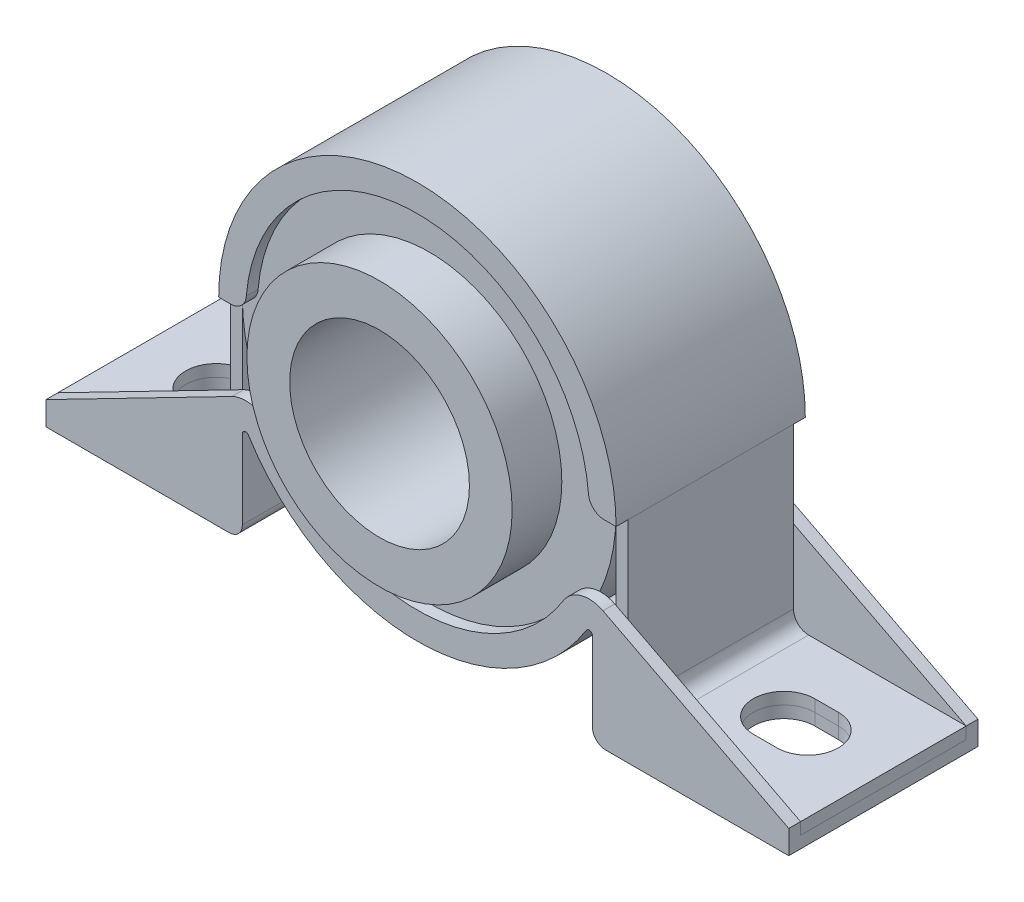
from build123d import *

# Parameters (mm, degrees)
EXTRUDE_THIN2_DEPTH  = 15.875
EXTRUDE1_DEPTH       = 1.984375
EXTRUDE_THIN3_START  = -13.890625
EXTRUDE_THIN3_DEPTH  = 27.78125
EXTRUDE2_DEPTH       = 1.984375
EXTRUDE3_START       = -13.890625
EXTRUDE3_OUTLINE_R   = 31.353125
EXTRUDE3_OUTLINE_R_2 = 22.2504
EXTRUDE3_DEPTH       = 27.78125
SKETCH8_R            = 22.2504
SKETCH8_R_2          = 15.08125
EXTRUDE4_DEPTH       = 30.1625
CUT_EXTRUDE1_DEPTH   = 75.079671598


# Read off the part's stored shape, not the designer's step: Extrude-Thin3, Extrude3
with BuildPart() as part:
    # Sketch1 → Extrude-Thin2 (new, symmetric)
    with BuildSketch(Plane.XY):
        with BuildLine():
            Line((-62.309375, -31.353125), (-31.607125, -31.353125))
            ThreePointArc((-31.607125, -31.353125), (-31.427519878, -31.278730122), (-31.353125, -31.099125))
            Line((-31.353125, -31.099125), (-31.353125, -17.84790604))
            ThreePointArc((-31.353125, -17.84790604), (-29.508461085, -15.404934953), (-26.653827576, -16.510358046))
            ThreePointArc((-26.653827576, -16.510358046), (0, -31.353125), (26.653827576, -16.510358046))
            ThreePointArc((26.653827576, -16.510358046), (29.508461085, -15.404934953), (31.353125, -17.84790604))
            Line((31.353125, -17.84790604), (31.353125, -31.099125))
            ThreePointArc((31.353125, -31.099125), (31.427519878, -31.278730122), (31.607125, -31.353125))
            Line((31.607125, -31.353125), (62.309375, -31.353125))
            Line((62.309375, -31.353125), (62.309375, -33.3375))
            Line((62.309375, -33.3375), (31.607125, -33.3375))
            ThreePointArc((31.607125, -33.3375), (30.024354859, -32.681895141), (29.36875, -31.099125))
            Line((29.36875, -31.099125), (29.36875, -17.84790604))
            ThreePointArc((29.36875, -17.84790604), (28.965229769, -17.313506115), (28.340778689, -17.555317416))
            ThreePointArc((28.340778689, -17.555317416), (0, -33.3375), (-28.340778689, -17.555317416))
            ThreePointArc((-28.340778689, -17.555317416), (-28.965229769, -17.313506115), (-29.36875, -17.84790604))
            Line((-29.36875, -17.84790604), (-29.36875, -31.099125))
            ThreePointArc((-29.36875, -31.099125), (-30.024354859, -32.681895141), (-31.607125, -33.3375))
            Line((-31.607125, -33.3375), (-62.309375, -33.3375))
            Line((-62.309375, -33.3375), (-62.309375, -31.353125))
        make_face()
    extrude(amount=EXTRUDE_THIN2_DEPTH, both=True)

    # Sketch4 → Extrude1 (add)
    with BuildSketch(Plane.XY.offset(15.875)):
        with BuildLine():
            Line((-62.309375, -29.36875), (-31.137213521, -13.330715259))
            ThreePointArc((-31.137213521, -13.330715259), (-27.455611767, -12.952647331), (-24.494530152, -15.172810052))
            ThreePointArc((-24.494530152, -15.172810052), (0, -28.813125), (24.494530152, -15.172810052))
            ThreePointArc((24.494530152, -15.172810052), (27.455611767, -12.952647331), (31.137213521, -13.330715259))
            Line((31.137213521, -13.330715259), (62.309375, -29.36875))
            Line((62.309375, -29.36875), (62.309375, -33.3375))
            Line((62.309375, -33.3375), (31.607125, -33.3375))
            ThreePointArc((31.607125, -33.3375), (30.024354859, -32.681895141), (29.36875, -31.099125))
            Line((29.36875, -31.099125), (29.36875, -17.84790604))
            ThreePointArc((29.36875, -17.84790604), (28.965229769, -17.313506115), (28.340778689, -17.555317416))
            ThreePointArc((28.340778689, -17.555317416), (0, -33.3375), (-28.340778689, -17.555317416))
            ThreePointArc((-28.340778689, -17.555317416), (-28.965229769, -17.313506115), (-29.36875, -17.84790604))
            Line((-29.36875, -17.84790604), (-29.36875, -31.099125))
            ThreePointArc((-29.36875, -31.099125), (-30.024354859, -32.681895141), (-31.607125, -33.3375))
            Line((-31.607125, -33.3375), (-62.309375, -33.3375))
            Line((-62.309375, -33.3375), (-62.309375, -29.36875))
        make_face()
    extrude1 = extrude(amount=-EXTRUDE1_DEPTH)

    # Mirror1: Extrude1 across plane
    add(extrude1.mirror(Plane.XY))


with BuildPart() as body_2:
    # Extrude-Thin3 outline → Extrude-Thin3 (new body)
    with BuildSketch(Plane.XY.offset(EXTRUDE_THIN3_START)):
        with BuildLine():
            Line((-35.8775, -29.36875), (-62.309375, -29.36875))
            Line((-62.309375, -29.36875), (-62.309375, -31.353125))
            Line((-62.309375, -31.353125), (-35.8775, -31.353125))
            ThreePointArc((-35.8775, -31.353125), (-32.678283757, -30.027966243), (-31.353125, -26.82875))
            Line((-31.353125, -26.82875), (-31.353125, 0))
            ThreePointArc((-31.353125, 0), (0, 31.353125), (31.353125, 0))
            Line((31.353125, 0), (31.353125, -26.82875))
            ThreePointArc((31.353125, -26.82875), (32.678283757, -30.027966243), (35.8775, -31.353125))
            Line((35.8775, -31.353125), (62.309375, -31.353125))
            Line((62.309375, -31.353125), (62.309375, -29.36875))
            Line((62.309375, -29.36875), (35.8775, -29.36875))
            ThreePointArc((35.8775, -29.36875), (34.081448776, -28.624801224), (33.3375, -26.82875))
            Line((33.3375, -26.82875), (33.3375, 0))
            ThreePointArc((33.3375, 0), (0, 33.3375), (-33.3375, 0))
            Line((-33.3375, 0), (-33.3375, -26.82875))
            ThreePointArc((-33.3375, -26.82875), (-34.081448776, -28.624801224), (-35.8775, -29.36875))
        make_face()
    extrude(amount=EXTRUDE_THIN3_DEPTH)

    # Sketch6 → Extrude2 (add)
    with BuildSketch(Plane(origin=(0, 0, -13.890625), x_dir=(-1, 0, 0), z_dir=(0, 0, -1))):
        with BuildLine():
            Line((-31.353125, 0), (-33.3375, 0))
            ThreePointArc((-33.3375, 0), (0, 33.3375), (33.3375, 0))
            Line((33.3375, 0), (31.353125, 0))
            ThreePointArc((31.353125, 0), (29.55867212, 0.699314359), (28.710605003, 2.428442428))
            ThreePointArc((28.710605003, 2.428442428), (0, 28.813125), (-28.710605003, 2.428442428))
            ThreePointArc((-28.710605003, 2.428442428), (-29.55867212, 0.699314359), (-31.353125, 0))
        make_face()
    extrude2 = extrude(amount=EXTRUDE2_DEPTH)

    # Mirror2: Extrude2 across plane
    add(extrude2.mirror(Plane.XY))


with BuildPart() as body_3:
    # Extrude3 outline → Extrude3 (new body)
    with BuildSketch(Plane.XY.offset(EXTRUDE3_START)):
        Circle(EXTRUDE3_OUTLINE_R)
        Circle(EXTRUDE3_OUTLINE_R_2, mode=Mode.SUBTRACT)
    extrude(amount=EXTRUDE3_DEPTH)


with BuildPart() as body_4:
    # Sketch8 → Extrude4 (new body)
    with BuildSketch(Plane.XY.offset(22.225)):
        Circle(SKETCH8_R)
        Circle(SKETCH8_R_2, mode=Mode.SUBTRACT)
    extrude(amount=-EXTRUDE4_DEPTH)


with BuildPart() as cut_extrude1_tool:
    # Sketch3 → Cut-Extrude1 (new, through all)
    with BuildSketch(Plane(origin=(0, 0, 0), x_dir=(1, 0, 0), z_dir=(0, 1, 0))):
        with BuildLine():
            Line((-49.609375, 5.159375), (-45.640625, 5.159375))
            ThreePointArc((-45.640625, 5.159375), (-40.48125, 0), (-45.640625, -5.159375))
            Line((-45.640625, -5.159375), (-49.609375, -5.159375))
            ThreePointArc((-49.609375, -5.159375), (-54.76875, 0), (-49.609375, 5.159375))
        make_face()
        with BuildLine():
            Line((45.640625, -5.159375), (49.609375, -5.159375))
            ThreePointArc((49.609375, -5.159375), (54.76875, 0), (49.609375, 5.159375))
            Line((49.609375, 5.159375), (45.640625, 5.159375))
            ThreePointArc((45.640625, 5.159375), (40.48125, 0), (45.640625, -5.159375))
        make_face()
    extrude(amount=-CUT_EXTRUDE1_DEPTH)


with BuildPart() as part_1:
    add(part.part)

    # Cut-Extrude1: cut by cut_extrude1_tool
    add(cut_extrude1_tool.part, mode=Mode.SUBTRACT)


with BuildPart() as body_2_1:
    add(body_2.part)

    # Cut-Extrude1: cut by cut_extrude1_tool
    add(cut_extrude1_tool.part, mode=Mode.SUBTRACT)


solid = Compound([body_3.part, body_4.part, part_1.part, body_2_1.part])
